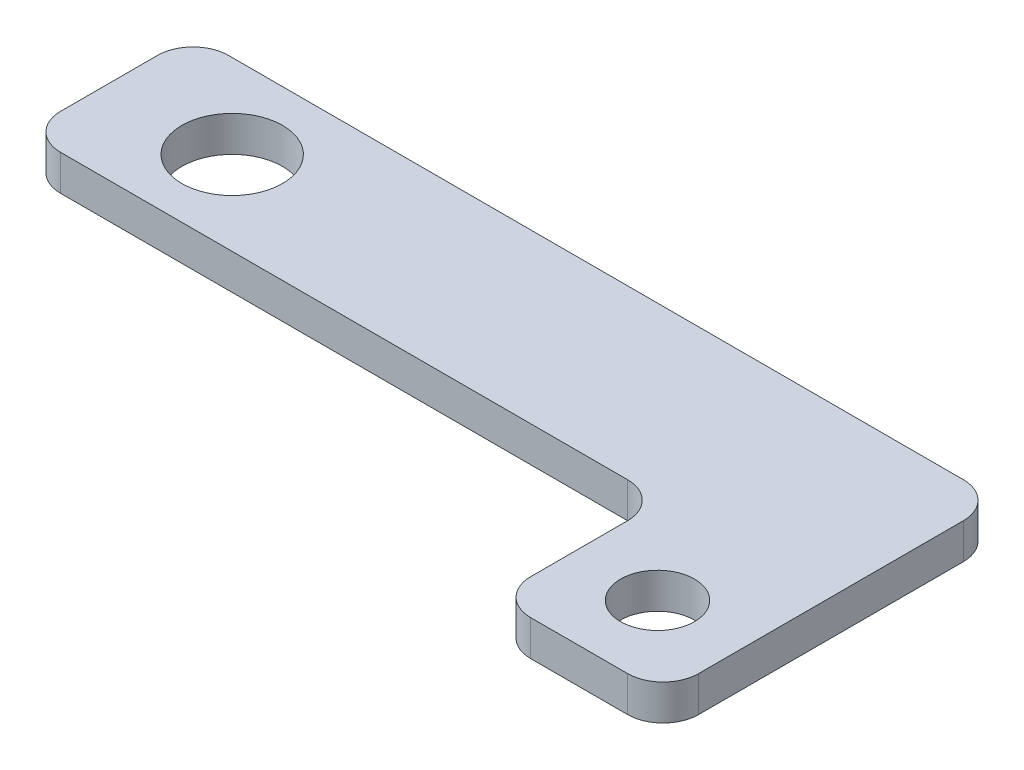
from build123d import *

# Parameters (mm, degrees)
BOSS_EXTRUDE1_DEPTH  = 3.175
M8_CLEARANCE_HOLE1_D = 9
M6_CLEARANCE_HOLE1_D = 6.6
FILLET1_R            = 3.175


with BuildPart() as part:
    # Sketch1 → Boss-Extrude1 (new body)
    with BuildSketch(Plane(origin=(0, 0, 0), x_dir=(1, 0, 0), z_dir=(0, 1, 0))):
        Polygon((10, -36.0812086), (56, -36.0812086), (56, -44.0812086), (56, -51.0812086), (71, -51.0812086), (71, -44.0812086), (71, -21.0812086), (10, -21.0812086), (-1, -21.0812086), (-1, -36.0812086), align=None)
    extrude(amount=-BOSS_EXTRUDE1_DEPTH)

    # M8 Clearance Hole1 (through all)
    with Locations(Plane(origin=(0, -3.175, 0), x_dir=(-1, 0, 0), z_dir=(0, -1, 0))):
        with Locations((-10, -28.5812086)):
            Hole(M8_CLEARANCE_HOLE1_D / 2)

    # M6 Clearance Hole1 (through all)
    with Locations(Plane(origin=(0, -3.175, 0), x_dir=(-1, 0, 0), z_dir=(0, -1, 0))):
        with Locations((-63.5, -44.0812086)):
            Hole(M6_CLEARANCE_HOLE1_D / 2)

    # Fillet1
    fillet1_edges = [part.edges().sort_by_distance(p)[0] for p in [
        (71, -1.5875, 21.0812086),
        (-1, -1.5875, 21.0812086),
        (-1, -1.5875, 36.0812086),
        (56, -1.5875, 36.0812086),
        (71, -1.5875, 51.0812086),
        (56, -1.5875, 51.0812086),
    ]]
    fillet(fillet1_edges, radius=FILLET1_R)


solid = part.part
